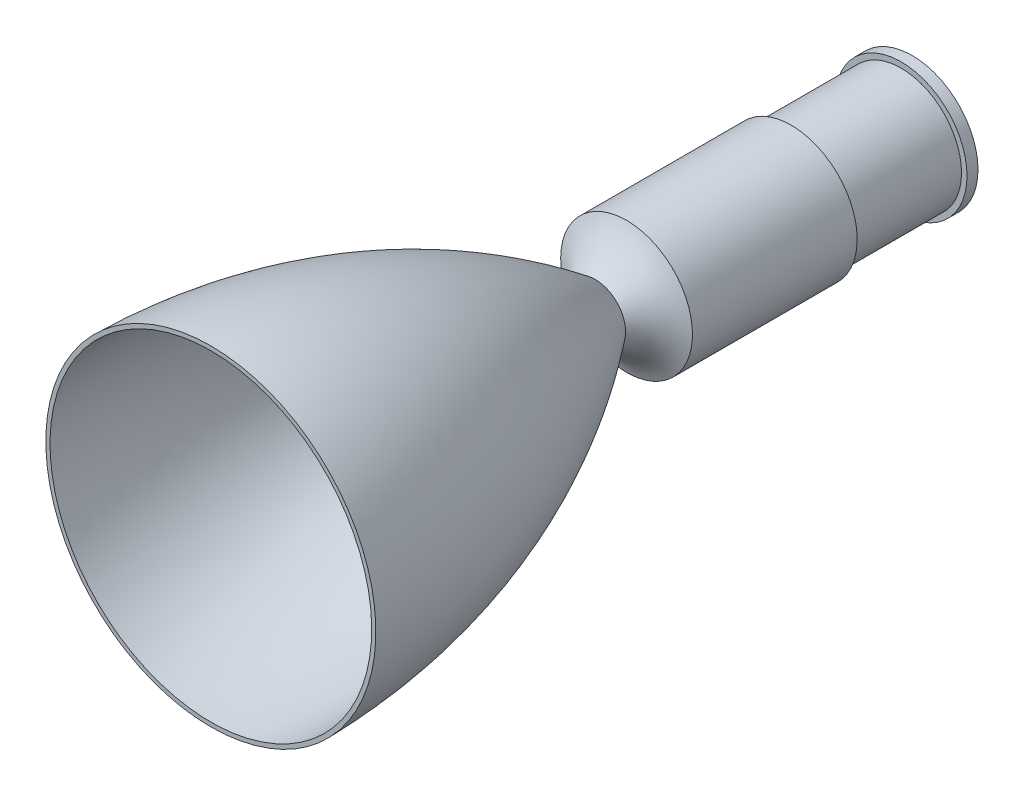
from build123d import *

# Parameters (mm, degrees)
SKETCH1_R           = 17.78
BOSS_EXTRUDE1_DEPTH = 5.08
SKETCH2_R           = 30.48
BOSS_EXTRUDE2_DEPTH = 5.08
SKETCH3_R           = 27.94
BOSS_EXTRUDE3_DEPTH = 50.8
SKETCH4_R           = 30.48
BOSS_EXTRUDE4_DEPTH = 76.2


with BuildPart() as part:
    # Sketch1 → Boss-Extrude1 (new body)
    with BuildSketch(Plane.XY):
        Circle(SKETCH1_R)
    extrude(amount=BOSS_EXTRUDE1_DEPTH)

    # Sketch2 → Boss-Extrude2 (add)
    with BuildSketch(Plane.XY.offset(5.08)):
        Circle(SKETCH2_R)
    extrude(amount=BOSS_EXTRUDE2_DEPTH)

    # Sketch3 → Boss-Extrude3 (add)
    with BuildSketch(Plane.XY.offset(10.16)):
        Circle(SKETCH3_R)
    extrude(amount=BOSS_EXTRUDE3_DEPTH)

    # Sketch4 → Boss-Extrude4 (add)
    with BuildSketch(Plane.XY.offset(60.96)):
        Circle(SKETCH4_R)
    extrude(amount=BOSS_EXTRUDE4_DEPTH)

    # Sketch5 → Revolve1 (revolve)
    with BuildSketch(Plane(origin=(0, 0, 0), x_dir=(0, 0, -1), z_dir=(1, 0, 0))):
        with BuildLine():
            Line((-137.16, 30.48), (-137.16, 26.560176078))
            add(Edge.make_bspline(
                [(-151.599198822, 12.390592164), (-141.986468175, 17.164576898), (-137.16, 26.560176078)],
                knots=[0, 0, 0, 1, 1, 1], degree=2))
            add(Edge.make_bspline(
                [(-151.599198822, 12.390592164), (-229.898810598, 73.137413834), (-329.438, 74.398984034)],
                knots=[0, 0, 0, 1, 1, 1], degree=2))
            Line((-329.438, 74.398984034), (-329.438, 76.327))
            add(Edge.make_bspline(
                [(-151.599198822, 14), (-230.05842127, 74.312145043), (-329.438, 76.327)],
                knots=[0, 0, 0, 1, 1, 1], degree=2))
            add(Edge.make_bspline(
                [(-151.599198822, 14), (-141.499539099, 19.826973138), (-137.16, 30.48)],
                knots=[0, 0, 0, 1, 1, 1], degree=2))
        make_face()
    revolve(axis=Axis((0, 0, 137.16), (0, 0, 1)))


solid = part.part
